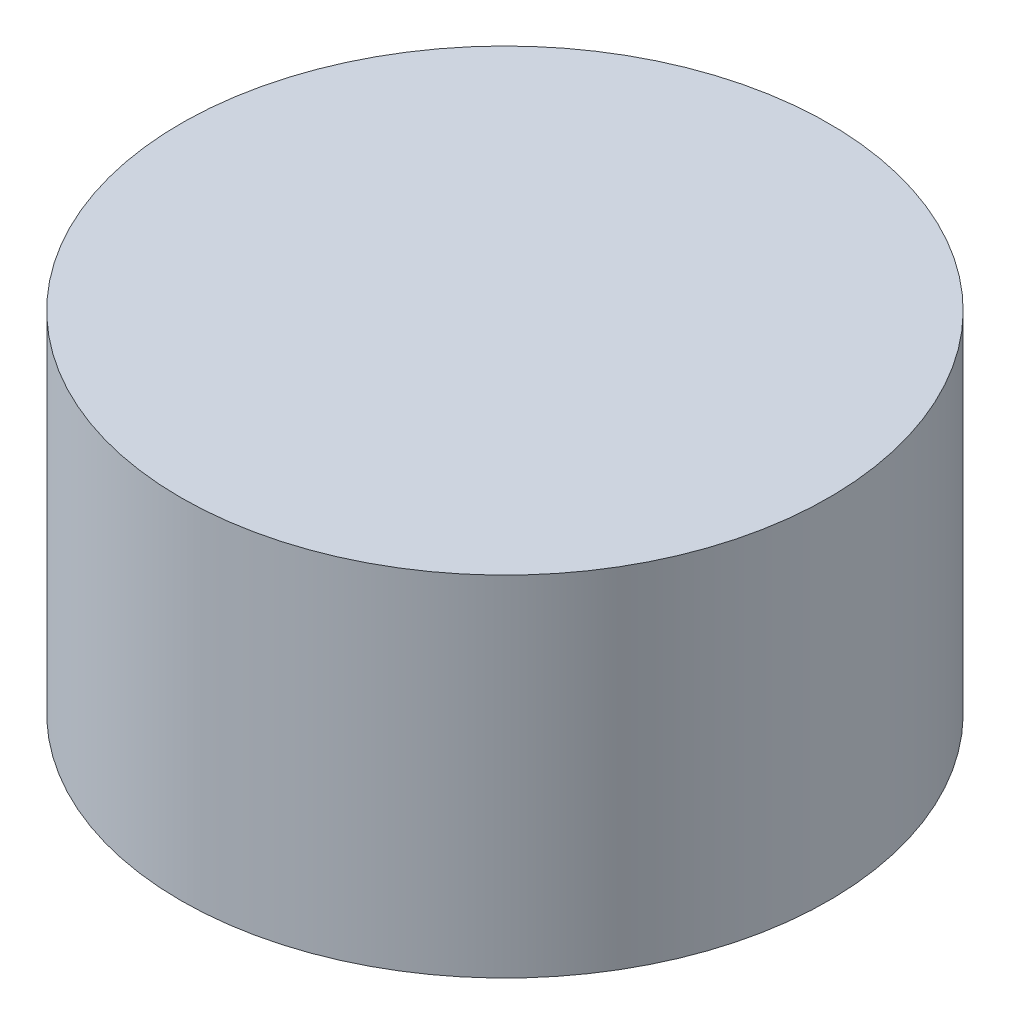
from build123d import *

# Parameters (mm, degrees)
SKETCH1_R           = 13
BOSS_EXTRUDE1_DEPTH = 14


with BuildPart() as part:
    # Sketch1 → Boss-Extrude1 (new body)
    with BuildSketch(Plane(origin=(0, 0, 0), x_dir=(1, 0, 0), z_dir=(0, 1, 0))):
        Circle(SKETCH1_R)
    extrude(amount=BOSS_EXTRUDE1_DEPTH)


solid = part.part
